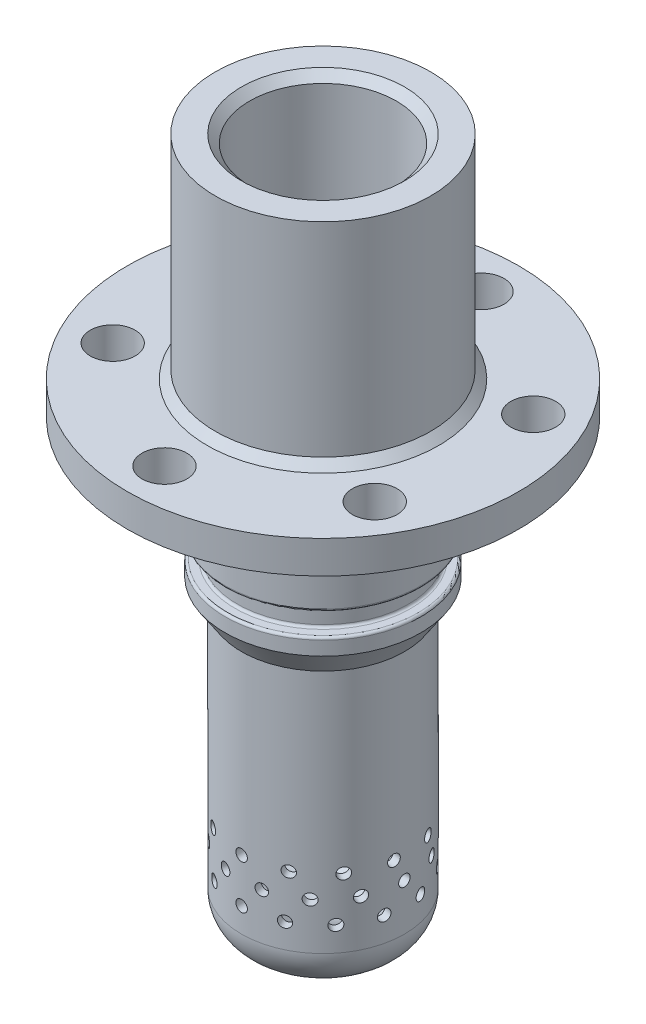
from build123d import *

# Parameters (mm, degrees)
ZAOKR_GLENIE1_R            = 5
SZKIC3_R                   = 0.7
WYTNIJ_WYCI_GNI_CIE1_DEPTH = 13
SZYK_KO_OWY1_COUNT         = 14
SZKIC4_R                   = 0.7
WYTNIJ_WYCI_GNI_CIE2_DEPTH = 13
SZYK_KO_OWY2_COUNT         = 14
SZKIC3_3_R                 = 0.7
WYTNIJ_WYCI_GNI_CIE3_DEPTH = 13
SZYK_KO_OWY3_COUNT         = 13
ZAOKR_GLENIE2_R            = 0.3
SFAZOWANIE1_SIZE           = 1
SZKIC5_R                   = 2.75
WYTNIJ_WYCI_GNI_CIE4_DEPTH = 13
SZYK_KO_OWY4_COUNT         = 6
SFAZOWANIE2_SIZE           = 0.4
SFAZOWANIE3_SIZE           = 1


with BuildPart() as part:
    # Szkic1 → Obrót1 (revolve)
    with BuildSketch(Plane.XY, mode=Mode.PRIVATE) as obr_t1_sk:
        Polygon((-9, -78.092254429), (-9, 0), (-13.2055, 0), (-13.2055, -26), (-24, -26), (-24, -30), (-12, -30), (-12, -42.3), (-10.5, -42.3), (-10.5, -45), (-12, -45), (-12, -47), (-10, -50), (-10, -85), (-0.7, -85), (-0.7, -83.079397567), align=None)
    revolve(obr_t1_sk.sketch.rotate(Axis((0, -85, 0), (0, 1, 0)), 270), axis=Axis((0, -85, 0), (0, 1, 0)))

    # Zaokrąglenie1
    zaokr_glenie1_edges = [part.edges().sort_by_distance(p)[0] for p in [
        (0, -85, 10),
    ]]
    fillet(zaokr_glenie1_edges, radius=ZAOKR_GLENIE1_R)

    # Szkic3 → Wytnij-wyciągnięcie1 (cut)
    with BuildSketch(Plane.XY):
        with Locations(Location((0, -77, 0), (0, 0, 180))):
            Circle(SZKIC3_R)
    wytnij_wyci_gni_cie1 = extrude(amount=WYTNIJ_WYCI_GNI_CIE1_DEPTH, mode=Mode.SUBTRACT)

    # Szyk kołowy1: Wytnij-wyciągnięcie1 ×14 about axis
    szyk_ko_owy1_axis = Axis((0, -85, 0), (0, -1, 0))
    for i in range(1, SZYK_KO_OWY1_COUNT):
        add(wytnij_wyci_gni_cie1.rotate(szyk_ko_owy1_axis, i * 360 / SZYK_KO_OWY1_COUNT), mode=Mode.SUBTRACT)

    # Szkic4 → Wytnij-wyciągnięcie2 (cut)
    with BuildSketch(Plane(origin=(0, 0, 0), x_dir=(0, 1, 0), z_dir=(0.22252088534002307, 0, 0.9749279232781736))):
        with Locations(Location((-74.3, 0, 0), (0, 0, 90))):
            Circle(SZKIC4_R)
    wytnij_wyci_gni_cie2 = extrude(amount=WYTNIJ_WYCI_GNI_CIE2_DEPTH, mode=Mode.SUBTRACT)

    # Szyk kołowy2: Wytnij-wyciągnięcie2 ×14 about axis
    szyk_ko_owy2_axis = Axis((0, -85, 0), (0, -1, 0))
    for i in range(1, SZYK_KO_OWY2_COUNT):
        add(wytnij_wyci_gni_cie2.rotate(szyk_ko_owy2_axis, i * 360 / SZYK_KO_OWY2_COUNT), mode=Mode.SUBTRACT)

    # Szkic3<3> → Wytnij-wyciągnięcie3 (cut)
    with BuildSketch(Plane.XY):
        with Locations(Location((0, -71.6, 0), (0, 0, 180))):
            Circle(SZKIC3_3_R)
    wytnij_wyci_gni_cie3 = extrude(amount=WYTNIJ_WYCI_GNI_CIE3_DEPTH, mode=Mode.SUBTRACT)

    # Szyk kołowy3: Wytnij-wyciągnięcie3 ×13 about axis
    szyk_ko_owy3_axis = Axis((0, -85, 0), (0, -1, 0))
    for i in range(1, SZYK_KO_OWY3_COUNT):
        add(wytnij_wyci_gni_cie3.rotate(szyk_ko_owy3_axis, i * 360 / SZYK_KO_OWY3_COUNT), mode=Mode.SUBTRACT)

    # Zaokrąglenie2
    zaokr_glenie2_edges = [part.edges().sort_by_distance(p)[0] for p in [
        (0, -45, 12),
        (0, -45, 10.5),
        (0, -42.3, 10.5),
        (0, -42.3, 12),
    ]]
    fillet(zaokr_glenie2_edges, radius=ZAOKR_GLENIE2_R)

    # Sfazowanie1
    sfazowanie1_edges = [part.edges().sort_by_distance(p)[0] for p in [
        (0, -26, 13.2055),
    ]]
    chamfer(sfazowanie1_edges, length=SFAZOWANIE1_SIZE)

    # Szkic5 → Wytnij-wyciągnięcie4 (cut)
    with BuildSketch(Plane(origin=(0, -26, 0), x_dir=(1, 0, 0), z_dir=(0, 1, 0))):
        with Locations(Location((0.444421233, 19, 0), (0, 0, 270))):
            Circle(SZKIC5_R)
    wytnij_wyci_gni_cie4 = extrude(amount=-WYTNIJ_WYCI_GNI_CIE4_DEPTH, mode=Mode.SUBTRACT)

    # Szyk kołowy4: Wytnij-wyciągnięcie4 ×6 about axis
    szyk_ko_owy4_axis = Axis((0, 0, 0), (0, 1, 0))
    for i in range(1, SZYK_KO_OWY4_COUNT):
        add(wytnij_wyci_gni_cie4.rotate(szyk_ko_owy4_axis, i * 360 / SZYK_KO_OWY4_COUNT), mode=Mode.SUBTRACT)

    # Sfazowanie2
    sfazowanie2_edges = [part.edges().sort_by_distance(p)[0] for p in [
        (0, -85, 0.7),
    ]]
    chamfer(sfazowanie2_edges, length=SFAZOWANIE2_SIZE)

    # Sfazowanie3
    sfazowanie3_edges = [part.edges().sort_by_distance(p)[0] for p in [
        (0, 0, 9),
    ]]
    chamfer(sfazowanie3_edges, length=SFAZOWANIE3_SIZE)


solid = part.part
